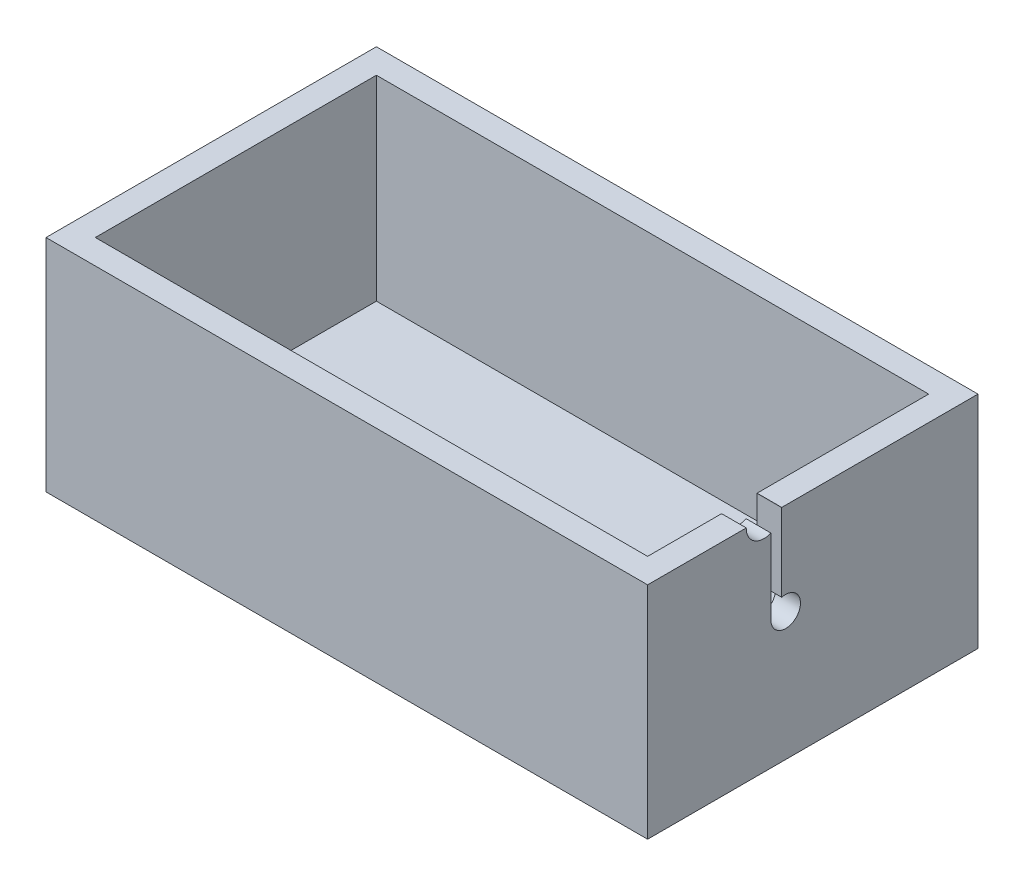
from build123d import *

# Parameters (mm, degrees)
SKETCH_1_W          = 112
SKETCH_1_H          = 57
EXTRUDE_1_DEPTH     = 89
SHELL_1_T           = 5
CUT_EXTRUDE_1_REACH = 152.772
SKETCH_3_W          = 67
SKETCH_3_H          = 49.31837687
CUT_EXTRUDE_2_DEPTH = 155.684356029


with BuildPart() as part:
    # 草图1 → 凸台-拉伸1 (new body)
    with BuildSketch(Plane(origin=(0, 0, 0), x_dir=(1, 0, 0), z_dir=(0, 1, 0))):
        Rectangle(SKETCH_1_W, SKETCH_1_H)
    extrude(amount=EXTRUDE_1_DEPTH)

    # 抽壳1
    shell_1_openings = [part.faces().sort_by_distance(p)[0] for p in [
        (0, 89, 0),
    ]]
    offset(amount=SHELL_1_T, openings=shell_1_openings, kind=Kind.INTERSECTION)

    # 草图2 → 切除-拉伸1 (cut, up to next)
    with BuildSketch(Plane(origin=(56, 0, 0), x_dir=(0, 0, -1), z_dir=(1, 0, 0)), mode=Mode.PRIVATE) as cut_extrude_1_sk1:
        with BuildLine():
            Line((-8.5, 21), (-8.5, 36.28337521))
            ThreePointArc((-8.5, 36.28337521), (-12.9, 41.589974874), (-6.3, 39.6))
            Line((-6.3, 39.6), (-6.3, 23.891366459))
            ThreePointArc((-6.3, 23.891366459), (-3.112532723, 19.183409788), (-8.5, 21))
        make_face()
    cut_extrude_1_tool1 = extrude(cut_extrude_1_sk1.sketch, amount=CUT_EXTRUDE_1_REACH, mode=Mode.PRIVATE) & part.part
    add(cut_extrude_1_tool1.solids().sort_by_distance((56, 31.418991, 7.879501))[0], mode=Mode.SUBTRACT)

    # 草图3 → 切除-拉伸2 (cut, through all)
    with BuildSketch(Plane(origin=(61, 0, 0), x_dir=(0, 0, -1), z_dir=(1, 0, 0))):
        with Locations((0, 64.340811565)):
            Rectangle(SKETCH_3_W, SKETCH_3_H)
    extrude(amount=-CUT_EXTRUDE_2_DEPTH, mode=Mode.SUBTRACT)


solid = part.part
